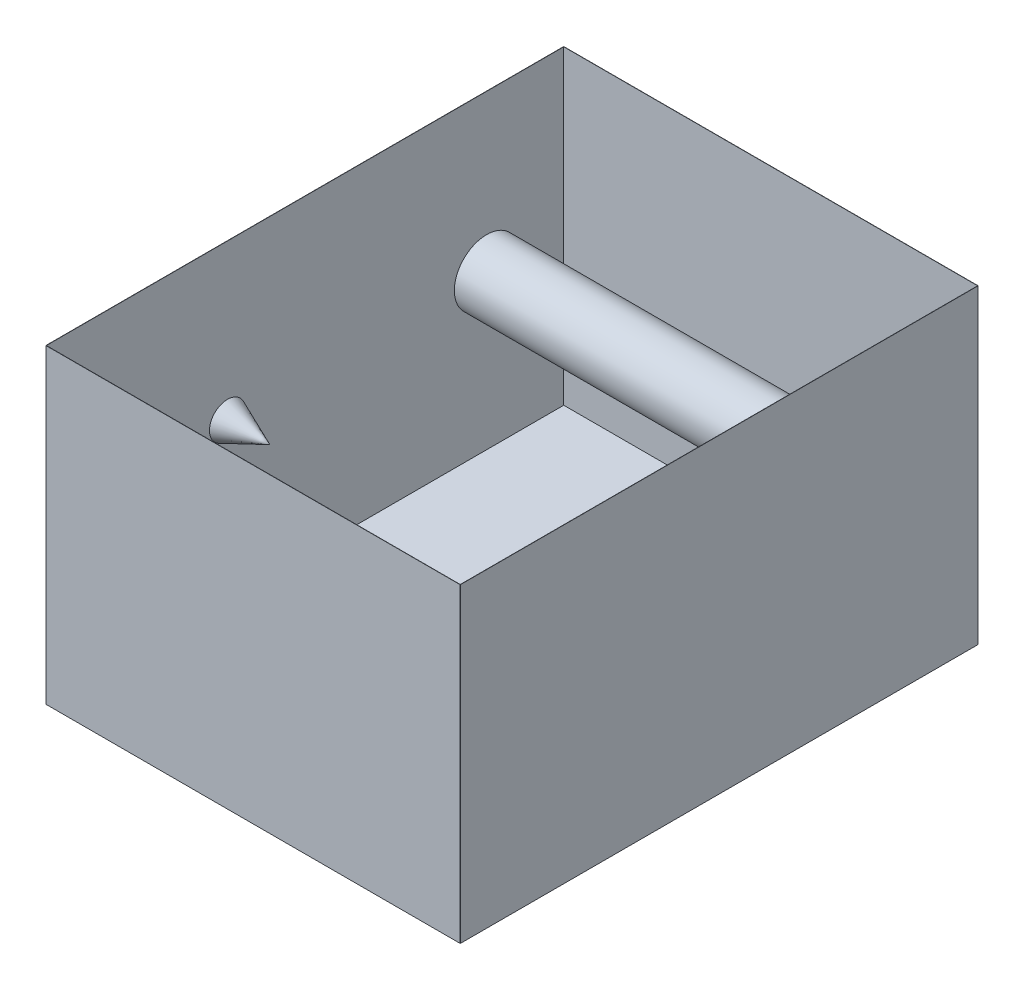
from build123d import *

# Parameters (mm, degrees)
SKETCH1_W               = 160
SKETCH1_H               = 200
BOSS_EXTRUDE1_DEPTH     = 120
SHELL1_T                = 0.1
BOSS_EXTRUDE2_START     = -160
BOSS_EXTRUDE2_OUTLINE_R = 12.5
BOSS_EXTRUDE2_DEPTH     = 159.9
FILLET3_R               = 0.1


# Read off the part's stored shape, not the designer's step: Boss-Extrude2
with BuildPart() as part:
    # Sketch1 → Boss-Extrude1 (new body)
    with BuildSketch(Plane(origin=(0, 0, 0), x_dir=(1, 0, 0), z_dir=(0, 1, 0))):
        with Locations((0, 3.38028169)):
            Rectangle(SKETCH1_W, SKETCH1_H)
    extrude(amount=BOSS_EXTRUDE1_DEPTH)

    # Shell1
    shell1_openings = [part.faces().sort_by_distance(p)[0] for p in [
        (0, 120, -3.38028169),
    ]]
    offset(amount=SHELL1_T, openings=shell1_openings, kind=Kind.INTERSECTION)

    # Boss-Extrude2 outline → Boss-Extrude2 (add)
    with BuildSketch(Plane(origin=(80.1, 0, 0), x_dir=(0, 0, -1), z_dir=(1, 0, 0)).offset(BOSS_EXTRUDE2_START)):
        with Locations((73.48028169, 59.62639051)):
            Circle(BOSS_EXTRUDE2_OUTLINE_R)
    extrude(amount=BOSS_EXTRUDE2_DEPTH)

    # Fillet3
    fillet3_edges = [part.edges().sort_by_distance(p)[0] for p in [
        (80.1, 59.95, -103.48028169),
        (80.1, 59.95, 96.71971831),
        (-80.1, 59.95, 96.71971831),
        (-80.1, 59.95, -103.48028169),
    ]]
    fillet(fillet3_edges, radius=FILLET3_R)

    # Boss-Extrude3 cone 1 section (through the dimple's axis) → Boss-Extrude3 (revolve)
    with BuildSketch(Plane(origin=(-80.1, 60, 26.61971831), x_dir=(0, 0, 1), z_dir=(0, 1, 0))):
        Polygon((0, 0), (7, 0), (0, 16.490966561), align=None)
    revolve(axis=Axis((-80.1, 60, 26.61971831), (1, 0, 0)))

    # Boss-Extrude4 cone 1 section (through the dimple's axis) → Boss-Extrude4 (revolve)
    with BuildSketch(Plane(origin=(80, 60, 26.61971831), x_dir=(0, 0, -1), z_dir=(0, 1, 0))):
        Polygon((0, 0), (7, 0), (0, 16.490966561), align=None)
    revolve(axis=Axis((80, 60, 26.61971831), (-1, 0, 0)))


solid = part.part
